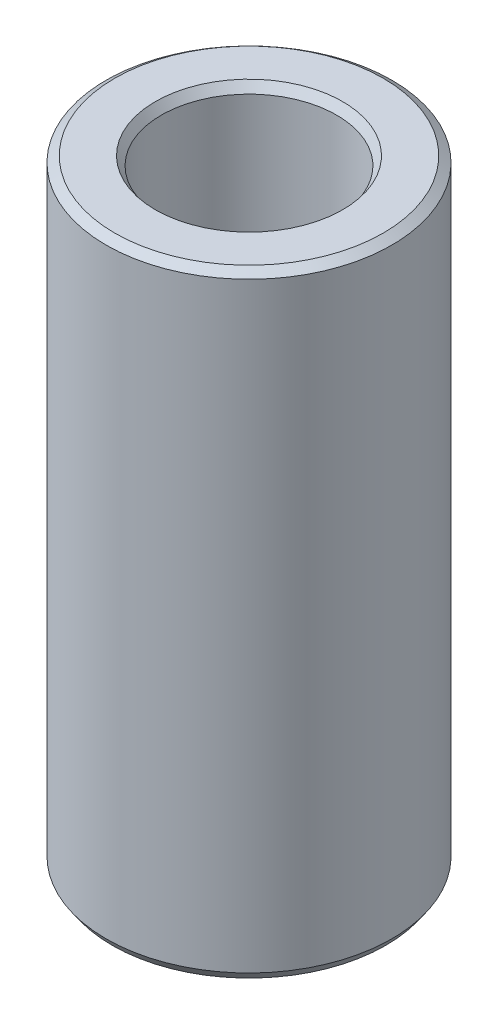
from build123d import *
from OCP.BRepFilletAPI import BRepFilletAPI_MakeChamfer

# Parameters (mm, degrees)
SKETCH1_R           = 12.5
BOSS_EXTRUDE1_DEPTH = 53.850769522
SKETCH2_R           = 7.670931036
CUT_EXTRUDE1_DEPTH  = 57.678085519
CHAMFER1_SIZE       = 0.527345687
CHAMFER1_SIZE2      = 0.75897655


with BuildPart() as part:
    # Sketch1 → Boss-Extrude1 (new body)
    with BuildSketch(Plane(origin=(0, 0, 0), x_dir=(1, 0, 0), z_dir=(0, 1, 0))):
        Circle(SKETCH1_R)
    extrude(amount=BOSS_EXTRUDE1_DEPTH)

    # Sketch2 → Cut-Extrude1 (cut, through all)
    with BuildSketch(Plane(origin=(0, 0, 0), x_dir=(1, 0, 0), z_dir=(0, 1, 0))):
        Circle(SKETCH2_R)
    extrude(amount=CUT_EXTRUDE1_DEPTH, mode=Mode.SUBTRACT)

    # Chamfer1: one chamfer whose edges measure the first distance from different faces: ONE call of the kernel's chamfer builder (chamfer() names one face for all edges)
    chamfer1_edges_1 = [part.edges().sort_by_distance(p)[0] for p in [
        (-7.670931036, 53.850769522, 0),
    ]]
    chamfer1_side_1 = [part.faces().sort_by_distance(p)[0] for p in [
        (-12.146446609, 53.850769522, 0),
    ]]
    chamfer1_edges_2 = [part.edges().sort_by_distance(p)[0] for p in [
        (-7.670931036, 0, 0),
    ]]
    chamfer1_side_2 = [part.faces().sort_by_distance(p)[0] for p in [
        (-7.670931036, 26.925384761, 0),
    ]]
    chamfer1_edges_3 = [part.edges().sort_by_distance(p)[0] for p in [
        (-12.5, 0, 0),
    ]]
    chamfer1_side_3 = [part.faces().sort_by_distance(p)[0] for p in [
        (-12.146446609, 0, 0),
    ]]
    chamfer1_edges_4 = [part.edges().sort_by_distance(p)[0] for p in [
        (-12.5, 53.850769522, 0),
    ]]
    chamfer1_side_4 = [part.faces().sort_by_distance(p)[0] for p in [
        (-12.5, 26.925384761, 0),
    ]]
    chamfer1 = BRepFilletAPI_MakeChamfer(part.part.solid().wrapped)
    for e in chamfer1_edges_1:
        chamfer1.Add(CHAMFER1_SIZE, CHAMFER1_SIZE2, e.wrapped, chamfer1_side_1[0].wrapped)  # the first distance lies on this face
    for e in chamfer1_edges_2:
        chamfer1.Add(CHAMFER1_SIZE, CHAMFER1_SIZE2, e.wrapped, chamfer1_side_2[0].wrapped)  # the first distance lies on this face
    for e in chamfer1_edges_3:
        chamfer1.Add(CHAMFER1_SIZE, CHAMFER1_SIZE2, e.wrapped, chamfer1_side_3[0].wrapped)  # the first distance lies on this face
    for e in chamfer1_edges_4:
        chamfer1.Add(CHAMFER1_SIZE, CHAMFER1_SIZE2, e.wrapped, chamfer1_side_4[0].wrapped)  # the first distance lies on this face
    add(Compound.cast(chamfer1.Shape()), mode=Mode.REPLACE)


solid = part.part
